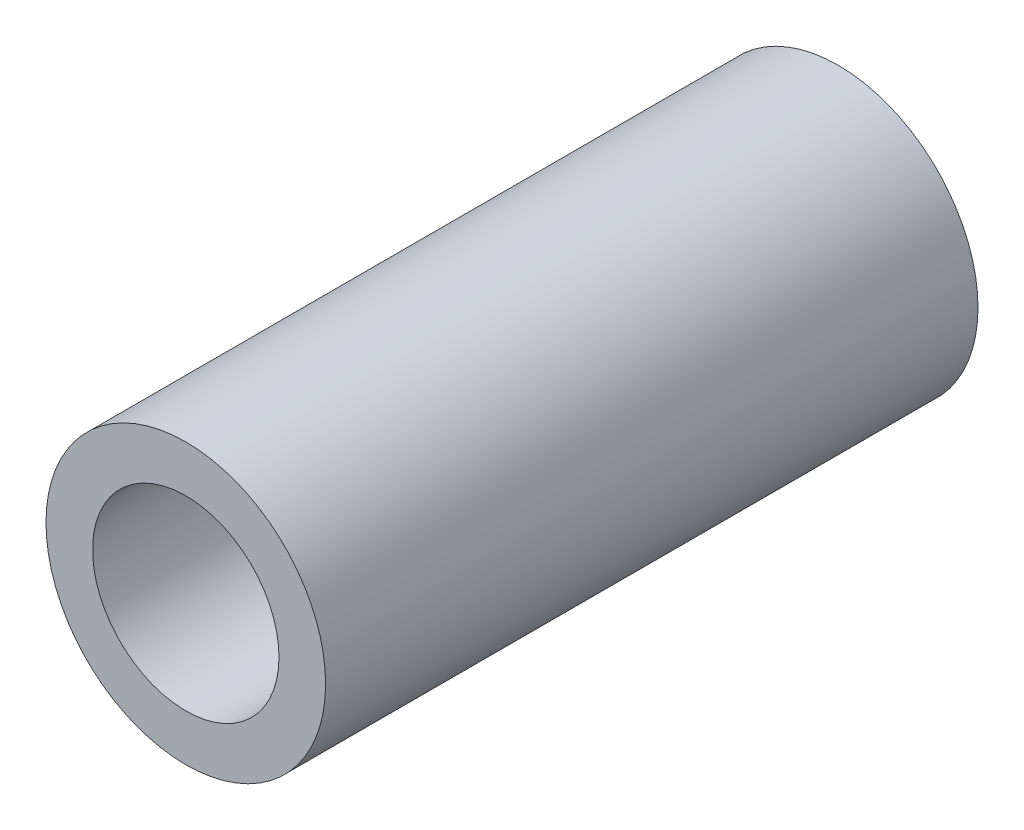
from build123d import *

# Parameters (mm, degrees)
ESQUISSE1_R             = 7.5
BOSS_EXTRU_1_DEPTH      = 35
ESQUISSE2_R             = 5
ENL_V_MAT_EXTRU_1_DEPTH = 16
ESQUISSE3_R             = 4.1
ENL_V_MAT_EXTRU_2_DEPTH = 16
BOSS_EXTRU_3_START      = 9
BOSS_EXTRU_3_DEPTH      = 9


with BuildPart() as part:
    # Esquisse1 → Boss.-Extru.1 (new body)
    with BuildSketch(Plane(origin=(0, 0, 0), x_dir=(0, 1, 0), z_dir=(0, 0, 1))):
        Circle(ESQUISSE1_R)
    extrude(amount=BOSS_EXTRU_1_DEPTH)

    # Esquisse2 → Enlèv. mat.-Extru.1 (cut)
    with BuildSketch(Plane.XY.offset(35)):
        Circle(ESQUISSE2_R)
    extrude(amount=-ENL_V_MAT_EXTRU_1_DEPTH, mode=Mode.SUBTRACT)

    # Esquisse3 → Enlèv. mat.-Extru.2 (cut)
    with BuildSketch(Plane(origin=(0, 0, 0), x_dir=(1, 0, 0), z_dir=(0, 0, -1))):
        Circle(ESQUISSE3_R)
    extrude(amount=-ENL_V_MAT_EXTRU_2_DEPTH, mode=Mode.SUBTRACT)

    # Esquisse5 → Boss.-Extru.3 (add)
    with BuildSketch(Plane(origin=(0, 0, 16), x_dir=(1, 0, 0), z_dir=(0, 0, -1)).offset(BOSS_EXTRU_3_START)):
        with BuildLine():
            Line((-2.856881783, 2.94078671), (3.293786669, 2.441509651))
            ThreePointArc((3.293786669, 2.441509651), (0.33172408, 4.086558348), (-2.856881783, 2.94078671))
        make_face()
    extrude(amount=-BOSS_EXTRU_3_DEPTH)


solid = part.part
